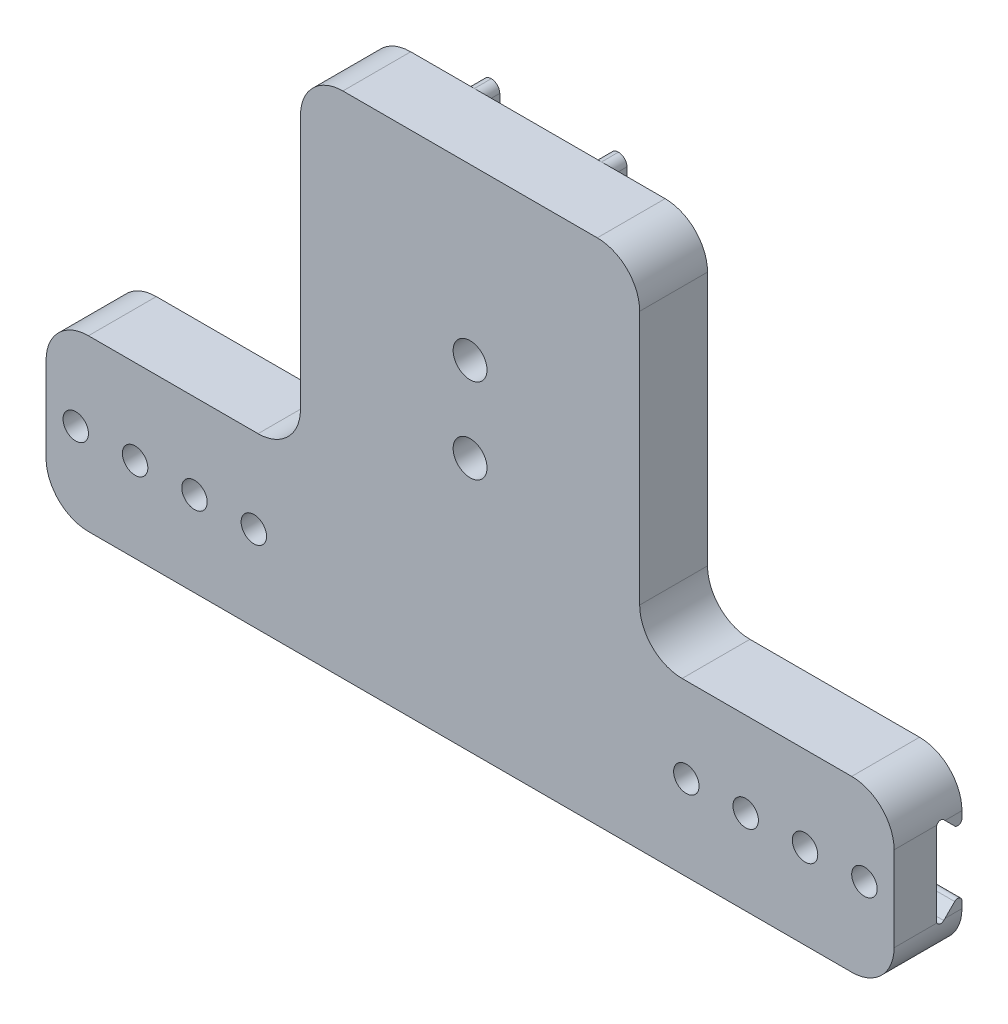
from build123d import *

# Parameters (mm, degrees)
SKETCH1_W               = 40
SKETCH1_H               = 8
BOSS_EXTRUDE1_DEPTH     = 60
SKETCH2_W               = 8
SKETCH2_H               = 20
BOSS_EXTRUDE2_DEPTH     = 30
CUT_EXTRUDE1_DEPTH      = 30
SKETCH6_R               = 1.5
CUT_EXTRUDE2_DEPTH      = 79.511145706
LPATTERN1_COUNT         = 4
LPATTERN1_PITCH         = 7
MIRROR3_COPY_1_SKETCH_R = 1.5
MIRROR3_COPY_1_DEPTH    = 79.511145706
MIRROR3_COPY_2_SKETCH_R = 1.5
MIRROR3_COPY_2_DEPTH    = 79.511145706
MIRROR3_COPY_3_SKETCH_R = 1.5
MIRROR3_COPY_3_DEPTH    = 79.511145706
SKETCH7_R               = 2
CUT_EXTRUDE3_DEPTH      = 30
SKETCH8_W               = 2
SKETCH8_H               = 60
BOSS_EXTRUDE3_DEPTH     = 2
FILLET1_R               = 1
FILLET1_OF_MIRROR4_R    = 1
FILLET2_R               = 0.5
FILLET3_R               = 5
SKETCH9_R               = 2
CUT_EXTRUDE4_DEPTH      = 10


# Some blends are built 0.0001 mm under size
with BuildPart() as part:
    # Sketch1 → Boss-Extrude1 (new body)
    with BuildSketch(Plane(origin=(0, 0, 0), x_dir=(1, 0, 0), z_dir=(0, 1, 0))):
        Rectangle(SKETCH1_W, SKETCH1_H)
    extrude(amount=-BOSS_EXTRUDE1_DEPTH)

    # Sketch2 → Boss-Extrude2 (add)
    with BuildSketch(Plane(origin=(20, 0, 0), x_dir=(0, 0, -1), z_dir=(1, 0, 0))):
        with Locations((0, -50)):
            Rectangle(SKETCH2_W, SKETCH2_H)
    boss_extrude2 = extrude(amount=BOSS_EXTRUDE2_DEPTH)

    # Sketch3 → Cut-Extrude1 (cut)
    with BuildSketch(Plane(origin=(50, 0, 0), x_dir=(0, 0, -1), z_dir=(1, 0, 0))):
        Polygon((1, -50), (1, -56), (4, -53), (4, -47), (1, -44), align=None)
    cut_extrude1 = extrude(amount=-CUT_EXTRUDE1_DEPTH, mode=Mode.SUBTRACT)

    # Sketch6 → Cut-Extrude2 (cut, through all)
    with BuildSketch(Plane.XY.offset(4)):
        with Locations((46.5, -50)):
            Circle(SKETCH6_R)
    cut_extrude2 = extrude(amount=-CUT_EXTRUDE2_DEPTH, mode=Mode.SUBTRACT)

    # LPattern1: Cut-Extrude2 ×4
    with Locations(*[(-i * LPATTERN1_PITCH, 0, 0) for i in range(1, LPATTERN1_COUNT)]):
        add(cut_extrude2, mode=Mode.SUBTRACT)

    # Mirror3: Boss-Extrude2, Cut-Extrude1, Cut-Extrude2 across plane
    add(boss_extrude2.mirror(Plane(origin=(0, 0, 0), x_dir=(0, 0, 1), z_dir=(1, 0, 0))))
    add(cut_extrude1.mirror(Plane(origin=(0, 0, 0), x_dir=(0, 0, 1), z_dir=(1, 0, 0))), mode=Mode.SUBTRACT)
    add(cut_extrude2.mirror(Plane(origin=(0, 0, 0), x_dir=(0, 0, 1), z_dir=(1, 0, 0))), mode=Mode.SUBTRACT)

    # Mirror3 copy 1 sketch → Mirror3 copy 1 (cut, through all)
    with BuildSketch(Plane(origin=(7, 0, 4), x_dir=(-1, 0, 0), z_dir=(0, 0, 1))):
        with Locations((46.5, 50)):
            Circle(MIRROR3_COPY_1_SKETCH_R)
    extrude(amount=-MIRROR3_COPY_1_DEPTH, mode=Mode.SUBTRACT)

    # Mirror3 copy 2 sketch → Mirror3 copy 2 (cut, through all)
    with BuildSketch(Plane(origin=(14, 0, 4), x_dir=(-1, 0, 0), z_dir=(0, 0, 1))):
        with Locations((46.5, 50)):
            Circle(MIRROR3_COPY_2_SKETCH_R)
    extrude(amount=-MIRROR3_COPY_2_DEPTH, mode=Mode.SUBTRACT)

    # Mirror3 copy 3 sketch → Mirror3 copy 3 (cut, through all)
    with BuildSketch(Plane(origin=(21, 0, 4), x_dir=(-1, 0, 0), z_dir=(0, 0, 1))):
        with Locations((46.5, 50)):
            Circle(MIRROR3_COPY_3_SKETCH_R)
    extrude(amount=-MIRROR3_COPY_3_DEPTH, mode=Mode.SUBTRACT)

    # Sketch7 → Cut-Extrude3 (cut)
    with BuildSketch(Plane.XY.offset(4)):
        with Locations((0, -30)):
            Circle(SKETCH7_R)
    extrude(amount=-CUT_EXTRUDE3_DEPTH, mode=Mode.SUBTRACT)

    # Sketch8 → Boss-Extrude3 (add)
    with BuildSketch(Plane(origin=(0, 0, -4), x_dir=(-1, 0, 0), z_dir=(0, 0, -1))):
        with Locations((-7.5, -30)):
            Rectangle(SKETCH8_W, SKETCH8_H)
    boss_extrude3 = extrude(amount=BOSS_EXTRUDE3_DEPTH)

    # Fillet1
    fillet1_edges = [part.edges().sort_by_distance(p)[0] for p in [
        (8.5, 0, -5),
        (6.5, 0, -5),
    ]]
    fillet(fillet1_edges, radius=FILLET1_R - 0.0001)  # a hair under: the kernel refuses the full size

    # Mirror4: Boss-Extrude3 across plane
    add(boss_extrude3.mirror(Plane(origin=(0, 0, 0), x_dir=(0, 0, 1), z_dir=(1, 0, 0))))

    # Fillet1 of Mirror4
    fillet1_of_mirror4_edges = [part.edges().sort_by_distance(p)[0] for p in [
        (-8.5, 0, -5),
        (-6.5, 0, -5),
    ]]
    fillet(fillet1_of_mirror4_edges, radius=FILLET1_OF_MIRROR4_R - 0.0001)  # a hair under: the kernel refuses the full size

    # Fillet2
    fillet2_edges = [part.edges().sort_by_distance(p)[0] for p in [
        (35, -44, -1),
        (35, -47, -4),
        (35, -53, -4),
        (35, -56, -1),
        (-35, -44, -1),
        (-35, -56, -1),
        (-35, -53, -4),
        (-35, -47, -4),
    ]]
    fillet(fillet2_edges, radius=FILLET2_R)

    # Fillet3
    # the kernel refuses this fillet: 5 mm, written as the material it adds along each edge
    with BuildSketch(Plane(origin=(20, -40, 4), x_dir=(1, 0, 0), z_dir=(0, 0, -1))) as fillet3_piece_1:
        with BuildLine():
            CenterArc((FILLET3_R, -FILLET3_R), FILLET3_R, 90, 90)
            Line((0, -FILLET3_R), (0, 0))
            Line((0, 0), (FILLET3_R, 0))
        make_face()
    extrude(amount=8)
    with BuildSketch(Plane(origin=(-20, -40, 4), x_dir=(-1, 0, 0), z_dir=(0, 0, -1))) as fillet3_piece_2:
        with BuildLine():
            CenterArc((FILLET3_R, FILLET3_R), FILLET3_R, 180, 90)
            Line((0, FILLET3_R), (0, 0))
            Line((0, 0), (FILLET3_R, 0))
        make_face()
    extrude(amount=8)
    # the kernel refuses this fillet: 5 mm, written as the material it takes off along each edge
    with BuildSketch(Plane(origin=(50, -60, -16.5), x_dir=(-1, 0, 0), z_dir=(0, 0, 1)), Plane(origin=(-50, -40, 16.5), x_dir=(0, -1, 0), z_dir=(0, 0, -1)), Plane(origin=(-50, -60, -16.5), x_dir=(0, 1, 0), z_dir=(0, 0, 1))) as fillet3_2_piece_1:
        with BuildLine():
            CenterArc((FILLET3_R, -FILLET3_R), FILLET3_R, 90, 90)
            Line((0, -FILLET3_R), (0, 0))
            Line((0, 0), (FILLET3_R, 0))
        make_face()
    extrude(amount=33, mode=Mode.SUBTRACT)
    with BuildSketch(Plane(origin=(50, -40, 16.5), x_dir=(0, -1, 0), z_dir=(0, 0, -1)), Plane(origin=(-20, 0, 16.5), x_dir=(1, 0, 0), z_dir=(0, 0, -1)), Plane(origin=(20, 0, -16.5), x_dir=(-1, 0, 0), z_dir=(0, 0, 1))) as fillet3_2_piece_2:
        with BuildLine():
            CenterArc((FILLET3_R, FILLET3_R), FILLET3_R, 180, 90)
            Line((0, FILLET3_R), (0, 0))
            Line((0, 0), (FILLET3_R, 0))
        make_face()
    extrude(amount=33, mode=Mode.SUBTRACT)

    # Sketch9 → Cut-Extrude4 (cut)
    with BuildSketch(Plane.XY.offset(4)):
        with Locations((0, -20)):
            Circle(SKETCH9_R)
    extrude(amount=-CUT_EXTRUDE4_DEPTH, mode=Mode.SUBTRACT)


solid = part.part
